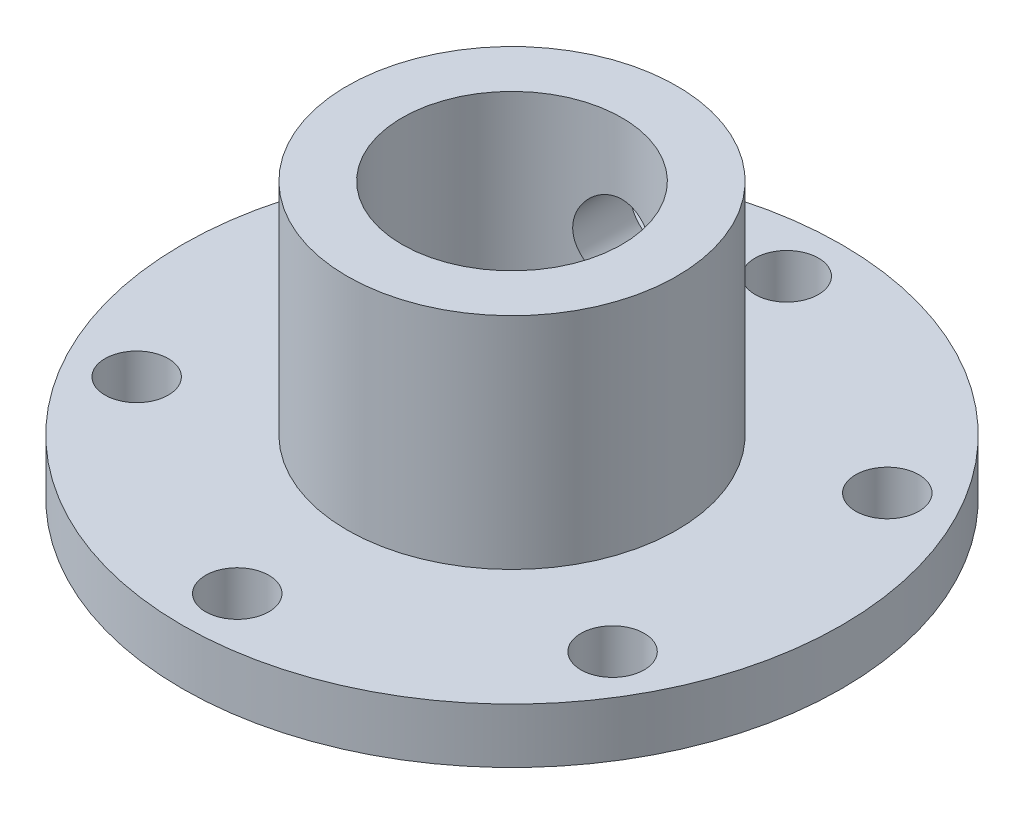
from build123d import *

# Parameters (mm, degrees)
SKETCH1_R           = 19.05
BOSS_EXTRUDE1_DEPTH = 3.175
SKETCH2_R           = 9.525
SKETCH2_R_2         = 6.35
BOSS_EXTRUDE2_DEPTH = 12.7
CIRPATTERN1_COUNT   = 6
SKETCH5_R           = 2.38125
CUT_EXTRUDE1_DEPTH  = 12.7


with BuildPart() as part:
    # Sketch1 → Boss-Extrude1 (new body)
    with BuildSketch(Plane(origin=(0, 0, 0), x_dir=(1, 0, 0), z_dir=(0, 1, 0))):
        Circle(SKETCH1_R)
    extrude(amount=BOSS_EXTRUDE1_DEPTH)

    # Sketch2 → Boss-Extrude2 (add)
    with BuildSketch(Plane(origin=(0, 3.175, 0), x_dir=(1, 0, 0), z_dir=(0, 1, 0))):
        Circle(SKETCH2_R)
        Circle(SKETCH2_R_2, mode=Mode.SUBTRACT)
    extrude(amount=BOSS_EXTRUDE2_DEPTH)

    # Sketch3 → #27 (0.144) Diameter Hole1 (revolve, cut)
    with BuildSketch(Plane(origin=(0, 3.175, 15.875), x_dir=(0, 0, 1), z_dir=(1, 0, 0))):
        Polygon((0, 0), (0, 26.4988539), (1.8288, 25.4), (1.8288, 0), align=None)
    f_27_0_144_diameter_hole1 = revolve(axis=Axis((0, 9.525, 15.875), (0, -1, 0)), mode=Mode.SUBTRACT)

    # CirPattern1: #27 (0.144) Diameter Hole1 ×6 about axis
    cirpattern1_axis = Axis((0, 15.875, 0), (0, -1, 0))
    for i in range(1, CIRPATTERN1_COUNT):
        add(f_27_0_144_diameter_hole1.rotate(cirpattern1_axis, i * 360 / CIRPATTERN1_COUNT), mode=Mode.SUBTRACT)

    # Sketch5 → Cut-Extrude1 (cut)
    with BuildSketch(Plane.XY):
        with Locations((0, 9.408949378)):
            Circle(SKETCH5_R)
    extrude(amount=-CUT_EXTRUDE1_DEPTH, mode=Mode.SUBTRACT)


solid = part.part
